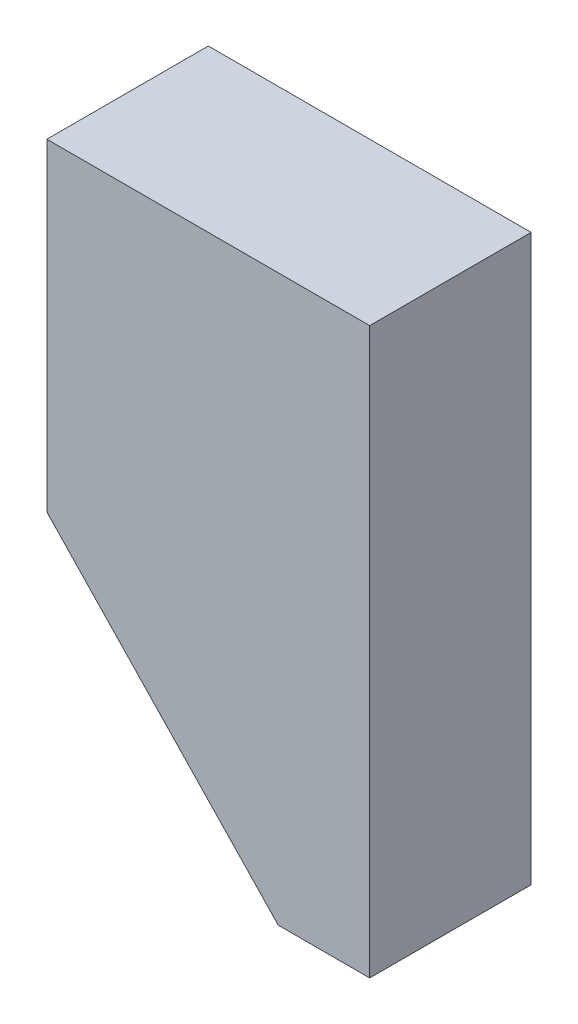
from build123d import *

# Parameters (mm, degrees)
BOSS_EXTRUDE1_DEPTH = 38.1


with BuildPart() as part:
    # Sketch1 → Boss-Extrude1 (new body)
    with BuildSketch(Plane.XY):
        Polygon((-19.398135965, 7.018421053), (56.801864035, 7.018421053), (56.801864035, -126.331578947), (35.211864035, -126.331578947), (-19.398135965, -69.181578947), align=None)
    extrude(amount=BOSS_EXTRUDE1_DEPTH)


solid = part.part
